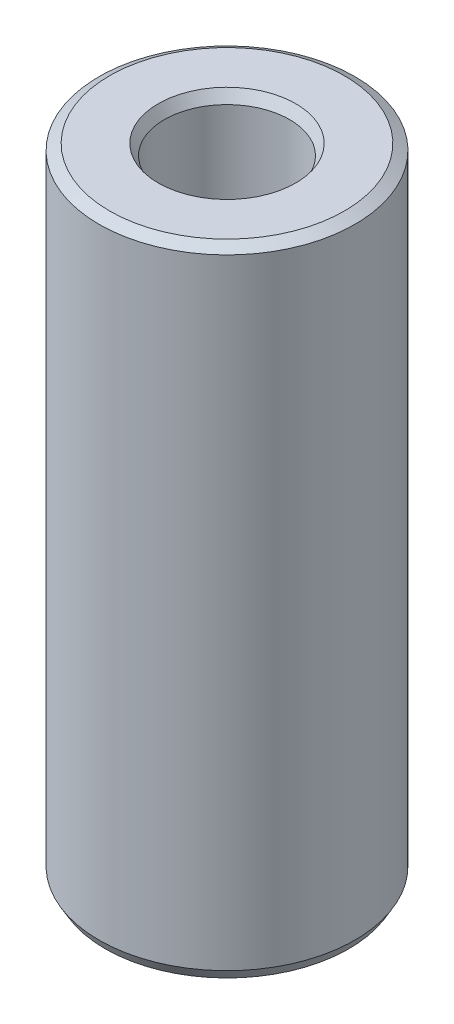
from build123d import *
from OCP.BRepFilletAPI import BRepFilletAPI_MakeChamfer

# Parameters (mm, degrees)
SKETCH1_R           = 5
BOSS_EXTRUDE1_DEPTH = 24.877584859
SKETCH2_R           = 2.44590848
CUT_EXTRUDE1_DEPTH  = 26.862989549
CHAMFER1_SIZE       = 0.240462044
CHAMFER1_SIZE2      = 0.416492477


with BuildPart() as part:
    # Sketch1 → Boss-Extrude1 (new body)
    with BuildSketch(Plane(origin=(0, 0, 0), x_dir=(1, 0, 0), z_dir=(0, 1, 0))):
        Circle(SKETCH1_R)
    extrude(amount=BOSS_EXTRUDE1_DEPTH)

    # Sketch2 → Cut-Extrude1 (cut, through all)
    with BuildSketch(Plane(origin=(0, 0, 0), x_dir=(1, 0, 0), z_dir=(0, 1, 0))):
        Circle(SKETCH2_R)
    extrude(amount=CUT_EXTRUDE1_DEPTH, mode=Mode.SUBTRACT)

    # Chamfer1: one chamfer whose edges measure the first distance from different faces: ONE call of the kernel's chamfer builder (chamfer() names one face for all edges)
    chamfer1_edges_1 = [part.edges().sort_by_distance(p)[0] for p in [
        (-2.44590848, 24.877584859, 0),
    ]]
    chamfer1_side_1 = [part.faces().sort_by_distance(p)[0] for p in [
        (-4.858578644, 24.877584859, 0),
    ]]
    chamfer1_edges_2 = [part.edges().sort_by_distance(p)[0] for p in [
        (-2.44590848, 0, 0),
    ]]
    chamfer1_side_2 = [part.faces().sort_by_distance(p)[0] for p in [
        (-2.44590848, 12.43879243, 0),
    ]]
    chamfer1_edges_3 = [part.edges().sort_by_distance(p)[0] for p in [
        (-5, 0, 0),
    ]]
    chamfer1_side_3 = [part.faces().sort_by_distance(p)[0] for p in [
        (-4.858578644, 0, 0),
    ]]
    chamfer1_edges_4 = [part.edges().sort_by_distance(p)[0] for p in [
        (-5, 24.877584859, 0),
    ]]
    chamfer1_side_4 = [part.faces().sort_by_distance(p)[0] for p in [
        (-5, 12.43879243, 0),
    ]]
    chamfer1 = BRepFilletAPI_MakeChamfer(part.part.solid().wrapped)
    for e in chamfer1_edges_1:
        chamfer1.Add(CHAMFER1_SIZE, CHAMFER1_SIZE2, e.wrapped, chamfer1_side_1[0].wrapped)  # the first distance lies on this face
    for e in chamfer1_edges_2:
        chamfer1.Add(CHAMFER1_SIZE, CHAMFER1_SIZE2, e.wrapped, chamfer1_side_2[0].wrapped)  # the first distance lies on this face
    for e in chamfer1_edges_3:
        chamfer1.Add(CHAMFER1_SIZE, CHAMFER1_SIZE2, e.wrapped, chamfer1_side_3[0].wrapped)  # the first distance lies on this face
    for e in chamfer1_edges_4:
        chamfer1.Add(CHAMFER1_SIZE, CHAMFER1_SIZE2, e.wrapped, chamfer1_side_4[0].wrapped)  # the first distance lies on this face
    add(Compound.cast(chamfer1.Shape()), mode=Mode.REPLACE)


solid = part.part
